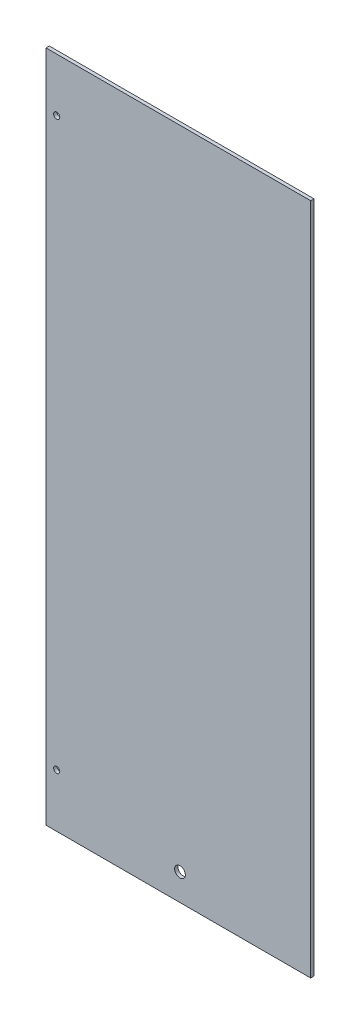
from build123d import *

# Parameters (mm, degrees)
SKETCH1_W        = 126.0475
SKETCH1_H        = 320.675
MAIN_PLATE_DEPTH = 1.5875
SKETCH2_R        = 1.4605
BOLT_HOLES_DEPTH = 6.35
LPATTERN1_COUNT  = 2
LPATTERN1_PITCH  = 269.875
SKETCH3_R        = 2.54
WIRE_HOLE_DEPTH  = 6.35


with BuildPart() as part:
    # Sketch1 → Main Plate (new body)
    with BuildSketch(Plane.XY):
        with Locations((63.02375, 160.3375)):
            Rectangle(SKETCH1_W, SKETCH1_H)
    extrude(amount=MAIN_PLATE_DEPTH)

    # Sketch2 → Bolt Holes (cut)
    with BuildSketch(Plane.XY.offset(1.5875)):
        with Locations((5.08, 295.275)):
            Circle(SKETCH2_R)
    bolt_holes = extrude(amount=-BOLT_HOLES_DEPTH, mode=Mode.SUBTRACT)

    # LPattern1: Bolt Holes ×2
    with Locations(*[(0, -i * LPATTERN1_PITCH, 0) for i in range(1, LPATTERN1_COUNT)]):
        add(bolt_holes, mode=Mode.SUBTRACT)

    # Sketch3 → Wire Hole (cut)
    with BuildSketch(Plane.XY.offset(1.5875)):
        with Locations((63.8175, 12.7)):
            Circle(SKETCH3_R)
    extrude(amount=-WIRE_HOLE_DEPTH, mode=Mode.SUBTRACT)


solid = part.part
